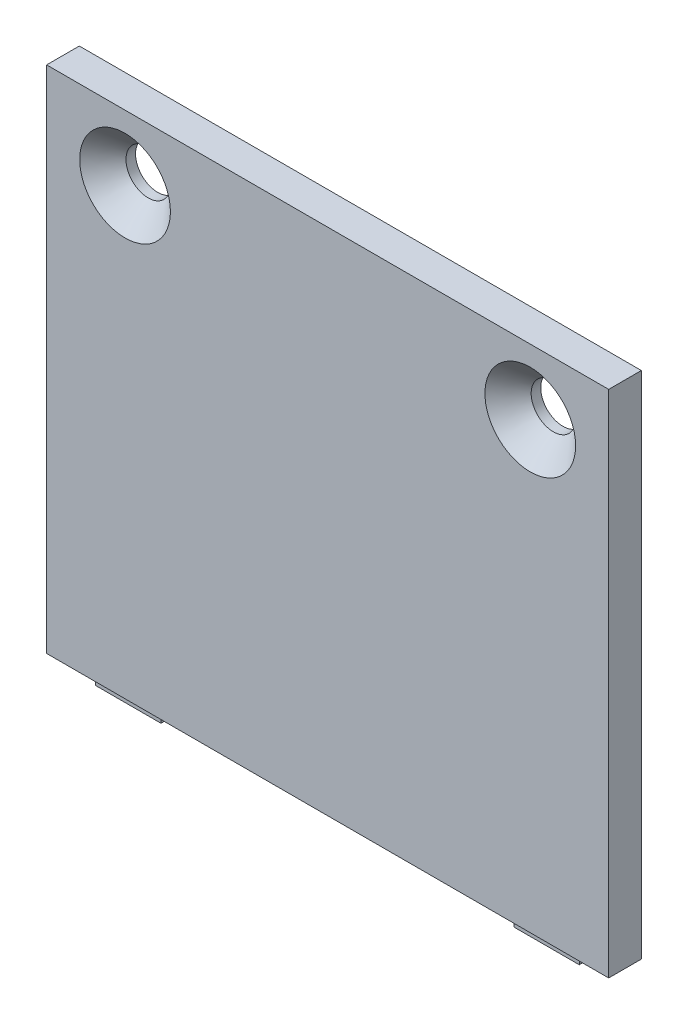
from build123d import *

# Parameters (mm, degrees)
CROQUIS1_W                                           = 43
CROQUIS1_H                                           = 39
SALIENTE_EXTRUIR1_DEPTH                              = 2.5
CROQUIS2_W                                           = 5
CROQUIS2_H                                           = 1
SALIENTE_EXTRUIR2_DEPTH                              = 1
AVELLANADO_PARA_TORNILLO_CON_CABEZA_AVEL_D           = 3.4
AVELLANADO_PARA_TORNILLO_CON_CABEZA_AVEL_DEPTH       = 12
AVELLANADO_PARA_TORNILLO_CON_CABEZA_AVEL_CSINK_D     = 6.94
AVELLANADO_PARA_TORNILLO_CON_CABEZA_AVEL_CSINK_ANGLE = 90
AVELLANADO_PARA_TORNILLO_CON_CABEZA_AVEL_TIP         = 1.021463052


with BuildPart() as part:
    # Croquis1 → Saliente-Extruir1 (new body)
    with BuildSketch(Plane.XY):
        Rectangle(CROQUIS1_W, CROQUIS1_H)
    extrude(amount=SALIENTE_EXTRUIR1_DEPTH)

    # Croquis2 → Saliente-Extruir2 (add)
    with BuildSketch(Plane.XZ.offset(19.5)):
        with Locations((-16, 1.25)):
            Rectangle(CROQUIS2_W, CROQUIS2_H)
        with Locations((16, 1.25)):
            Rectangle(CROQUIS2_W, CROQUIS2_H)
    extrude(amount=SALIENTE_EXTRUIR2_DEPTH)

    # Avellanado para tornillo con cabeza avellanada de clavija hexagonal de M31
    with Locations(Plane(origin=(-15.5, 14.5, 2.5), x_dir=(1, 0, 0), z_dir=(0, 0, 1))):
        with Locations((0, 0), (31, 0)):
            CounterSinkHole(AVELLANADO_PARA_TORNILLO_CON_CABEZA_AVEL_D / 2, AVELLANADO_PARA_TORNILLO_CON_CABEZA_AVEL_CSINK_D / 2, depth=AVELLANADO_PARA_TORNILLO_CON_CABEZA_AVEL_DEPTH, counter_sink_angle=AVELLANADO_PARA_TORNILLO_CON_CABEZA_AVEL_CSINK_ANGLE)
            with Locations((0, 0, -(AVELLANADO_PARA_TORNILLO_CON_CABEZA_AVEL_DEPTH + AVELLANADO_PARA_TORNILLO_CON_CABEZA_AVEL_TIP / 2))):  # 118° drill point
                Cone(0, AVELLANADO_PARA_TORNILLO_CON_CABEZA_AVEL_D / 2, AVELLANADO_PARA_TORNILLO_CON_CABEZA_AVEL_TIP, mode=Mode.SUBTRACT)


solid = part.part
